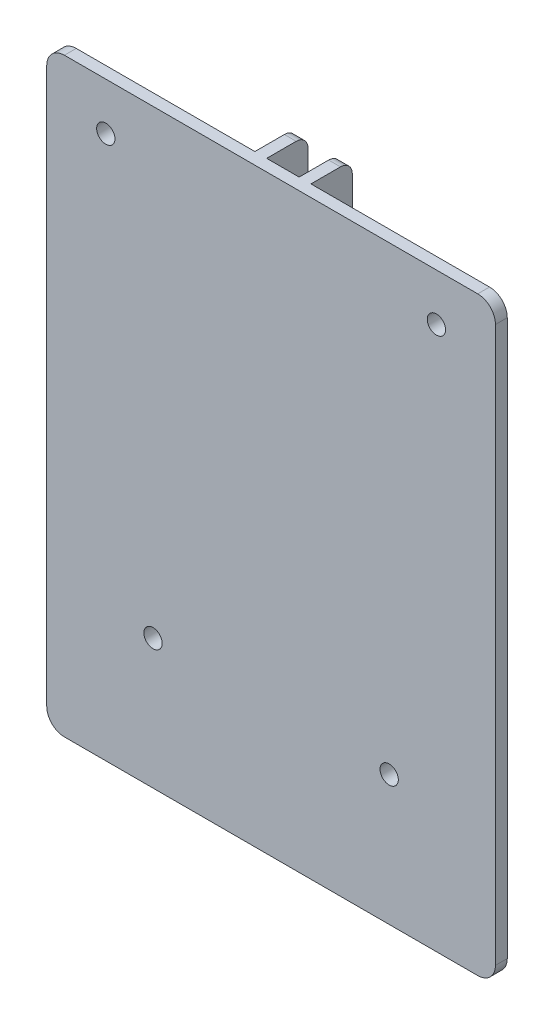
from build123d import *

# Parameters (mm, degrees)
ESQUISSE1_W                  = 76
ESQUISSE1_H                  = 100
BOSS_EXTRU_1_DEPTH           = 9
ESQUISSE2_W                  = 33.25
ESQUISSE2_H                  = 100
ESQUISSE2_W_2                = 5.5
ENL_V_MAT_EXTRU_1_DEPTH      = 7
ESQUISSE3_R                  = 1.55
ENL_V_MAT_EXTRU_2_DEPTH      = 110.126360244
CONG_1_R                     = 3
CONG_2_R                     = 2
ESQUISSE9_R                  = 3
BOSS_EXTRU_2_DEPTH           = 3
ENL_V_MAT_EXTRU_4_DEPTH      = 126.797456254
ENL_V_MAT_EXTRU_4_DEPTH_BACK = 126.797456254
ESQUISSE5_R                  = 1.55


with BuildPart() as part:
    # Esquisse1 → Boss.-Extru.1 (new body)
    with BuildSketch(Plane.XY):
        with Locations((38, 50)):
            Rectangle(ESQUISSE1_W, ESQUISSE1_H)
    extrude(amount=BOSS_EXTRU_1_DEPTH)

    # Esquisse2 → Enlèv. mat.-Extru.1 (cut)
    with BuildSketch(Plane(origin=(0, 0, 0), x_dir=(-1, 0, 0), z_dir=(0, 0, -1))):
        with Locations((-16.625, 50)):
            Rectangle(ESQUISSE2_W, ESQUISSE2_H)
        with Locations((-59.375, 50)):
            Rectangle(ESQUISSE2_W, ESQUISSE2_H)
        with Locations((-38, 50)):
            Rectangle(ESQUISSE2_W_2, ESQUISSE2_H)
    extrude(amount=-ENL_V_MAT_EXTRU_1_DEPTH, mode=Mode.SUBTRACT)

    # Esquisse3 → Enlèv. mat.-Extru.2 (cut, through all)
    with BuildSketch(Plane(origin=(42.75, 0, 0), x_dir=(0, 0, -1), z_dir=(1, 0, 0))):
        with Locations((-3.5, 20)):
            Circle(ESQUISSE3_R)
        with Locations((-3.5, 90)):
            Circle(ESQUISSE3_R)
    extrude(amount=-ENL_V_MAT_EXTRU_2_DEPTH, mode=Mode.SUBTRACT)

    # Congé1
    cong_1_edges = [part.edges().sort_by_distance(p)[0] for p in [
        (0, 0, 8),
        (76, 0, 8),
        (0, 100, 8),
        (76, 100, 8),
    ]]
    fillet(cong_1_edges, radius=CONG_1_R)

    # Congé2
    cong_2_edges = [part.edges().sort_by_distance(p)[0] for p in [
        (34.25, 0, 0),
        (41.75, 0, 0),
        (34.25, 100, 0),
        (41.75, 100, 0),
    ]]
    fillet(cong_2_edges, radius=CONG_2_R)

    # Esquisse9 → Boss.-Extru.2 (add)
    with BuildSketch(Plane(origin=(0, 0, 7), x_dir=(-1, 0, 0), z_dir=(0, 0, -1))):
        with Locations((-66, 92)):
            Circle(ESQUISSE9_R)
        with Locations((-10, 92)):
            Circle(ESQUISSE9_R)
        with Locations((-18, 22)):
            Circle(ESQUISSE9_R)
        with Locations((-58, 22)):
            Circle(ESQUISSE9_R)
    extrude(amount=BOSS_EXTRU_2_DEPTH)

    # Esquisse5 → Enlèv. mat.-Extru.4 (cut, two sides: drawn at the far end of the back side and taken through both)
    with BuildSketch(Plane(origin=(0, 0, 7), x_dir=(-1, 0, 0), z_dir=(0, 0, -1)).offset(-ENL_V_MAT_EXTRU_4_DEPTH_BACK)):
        with Locations((-66, 92)):
            Circle(ESQUISSE5_R)
        with Locations((-58, 22)):
            Circle(ESQUISSE5_R)
        with Locations((-18, 22)):
            Circle(ESQUISSE5_R)
        with Locations((-10, 92)):
            Circle(ESQUISSE5_R)
    extrude(amount=ENL_V_MAT_EXTRU_4_DEPTH + ENL_V_MAT_EXTRU_4_DEPTH_BACK, mode=Mode.SUBTRACT)


solid = part.part
